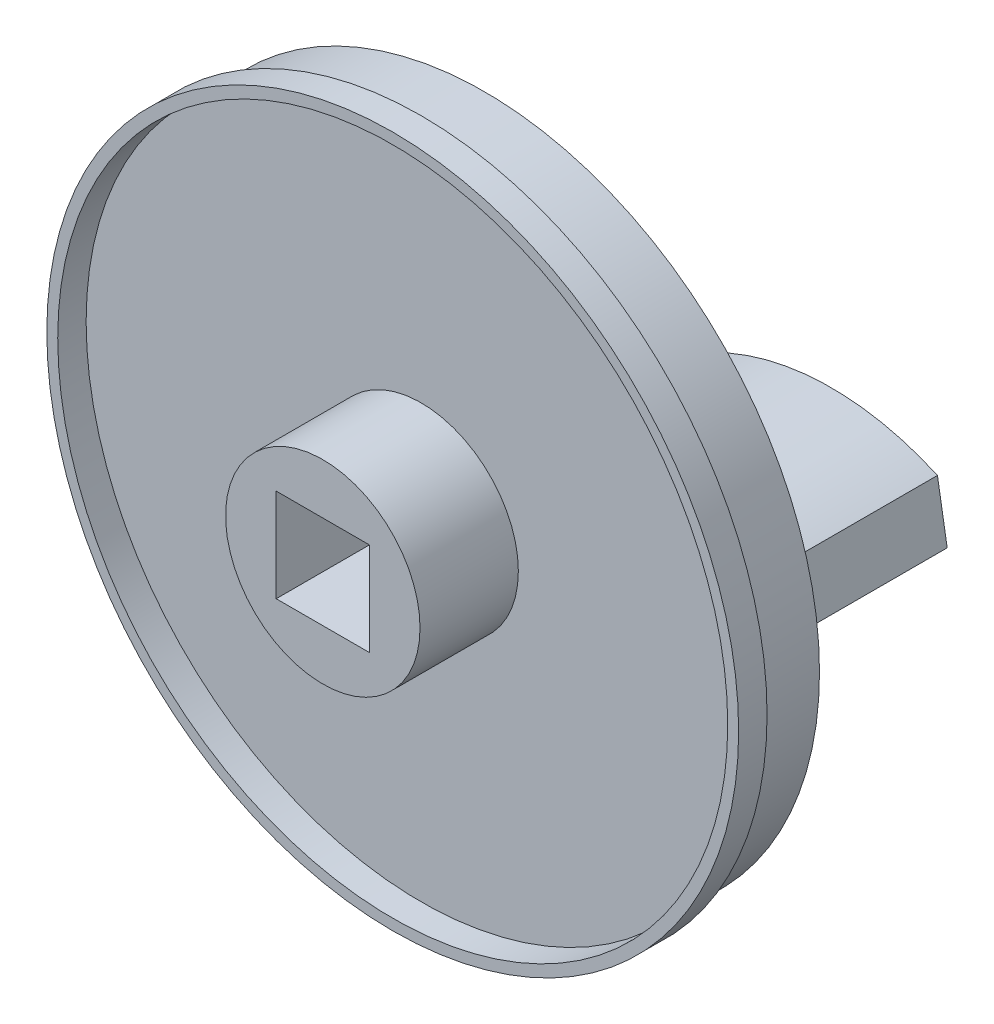
from build123d import *

# Parameters (mm, degrees)
SKETCH1_R           = 11.684
BOSS_EXTRUDE1_DEPTH = 1.2192
SKETCH2_R           = 3.3909
SKETCH2_W           = 3.2512
SKETCH2_H           = 3.2512
BOSS_EXTRUDE2_DEPTH = 3.429
SKETCH3_R           = 12.065
SKETCH3_R_2         = 11.684
BOSS_EXTRUDE3_DEPTH = 0.9906
BOSS_EXTRUDE4_START = 0.9906
SKETCH4_R           = 11.684
SKETCH4_R_2         = 10.6934
SKETCH4_R_3         = 3.81
BOSS_EXTRUDE4_DEPTH = 0.9906
SKETCH5_R           = 2.9591
BOSS_EXTRUDE5_DEPTH = 4.826
BOSS_EXTRUDE7_DEPTH = 5.8166


# Read off the part's stored shape, not the designer's step: Boss-Extrude7
with BuildPart() as part:
    # Sketch1 → Boss-Extrude1 (new body)
    with BuildSketch(Plane.XY):
        Circle(SKETCH1_R)
    extrude(amount=BOSS_EXTRUDE1_DEPTH)

    # Sketch2 → Boss-Extrude2 (add)
    with BuildSketch(Plane.XY.offset(1.2192)):
        Circle(SKETCH2_R)
        Rectangle(SKETCH2_W, SKETCH2_H, mode=Mode.SUBTRACT)
    extrude(amount=BOSS_EXTRUDE2_DEPTH)

    # Sketch4 → Boss-Extrude4 (add)
    # profile 1 of 2: a face of its own
    with BuildSketch(Plane(origin=(0, 0, 0), x_dir=(-1, 0, 0), z_dir=(0, 0, -1)).offset(BOSS_EXTRUDE4_START)):
        with Locations(Location((0, 0, 0), (0, 0, 180))):
            Circle(SKETCH4_R)
        Circle(SKETCH4_R_2, mode=Mode.SUBTRACT)
    # profile 2 of 2: a face of its own
    with BuildSketch(Plane(origin=(0, 0, 0), x_dir=(-1, 0, 0), z_dir=(0, 0, -1)).offset(BOSS_EXTRUDE4_START)):
        with Locations(Location((0, 0, 0), (0, 0, 180))):
            Circle(SKETCH4_R_3)
    extrude(amount=-BOSS_EXTRUDE4_DEPTH)

    # Sketch5 → Boss-Extrude5 (add)
    with BuildSketch(Plane(origin=(0, 0, -0.9906), x_dir=(-1, 0, 0), z_dir=(0, 0, -1))):
        Circle(SKETCH5_R)
    extrude(amount=BOSS_EXTRUDE5_DEPTH)


with BuildPart() as body_2:
    # Sketch3 → Boss-Extrude3 (new body)
    with BuildSketch(Plane.XY.offset(1.2192)):
        Circle(SKETCH3_R)
        Circle(SKETCH3_R_2, mode=Mode.SUBTRACT)
    extrude(amount=BOSS_EXTRUDE3_DEPTH)


with BuildPart() as body_3:
    # Boss-Extrude7 outline → Boss-Extrude7 (new body)
    with BuildSketch(Plane(origin=(0, 0, 0), x_dir=(-1, 0, 0), z_dir=(0, 0, -1))):
        with BuildLine():
            ThreePointArc((-1.953753259, 2.222413331), (-6.3351355, 3.914810369), (-10.971663942, 3.164262512))
            Line((-10.971663942, 3.164262512), (-11.311701793, 1.147110303))
            ThreePointArc((-11.311701793, 1.147110303), (-7.016280611, 3.05911682), (-2.646540618, 1.323667469))
            ThreePointArc((-2.646540618, 1.323667469), (-2.343632217, 1.8065605), (-1.953753259, 2.222413331))
        make_face()
        with BuildLine():
            ThreePointArc((11.311701793, 1.147110303), (7.1157256, -0.714132536), (2.818783903, 0.900405531))
            ThreePointArc((2.818783903, 0.900405531), (2.9591, 0), (2.818783903, -0.900405531))
            ThreePointArc((2.818783903, -0.900405531), (6.897015449, -1.862296256), (10.967806427, -0.869387837))
            Line((10.967806427, -0.869387837), (11.311701793, 1.147110303))
        make_face()
    extrude(amount=BOSS_EXTRUDE7_DEPTH)


solid = Compound([part.part, body_2.part, body_3.part])
